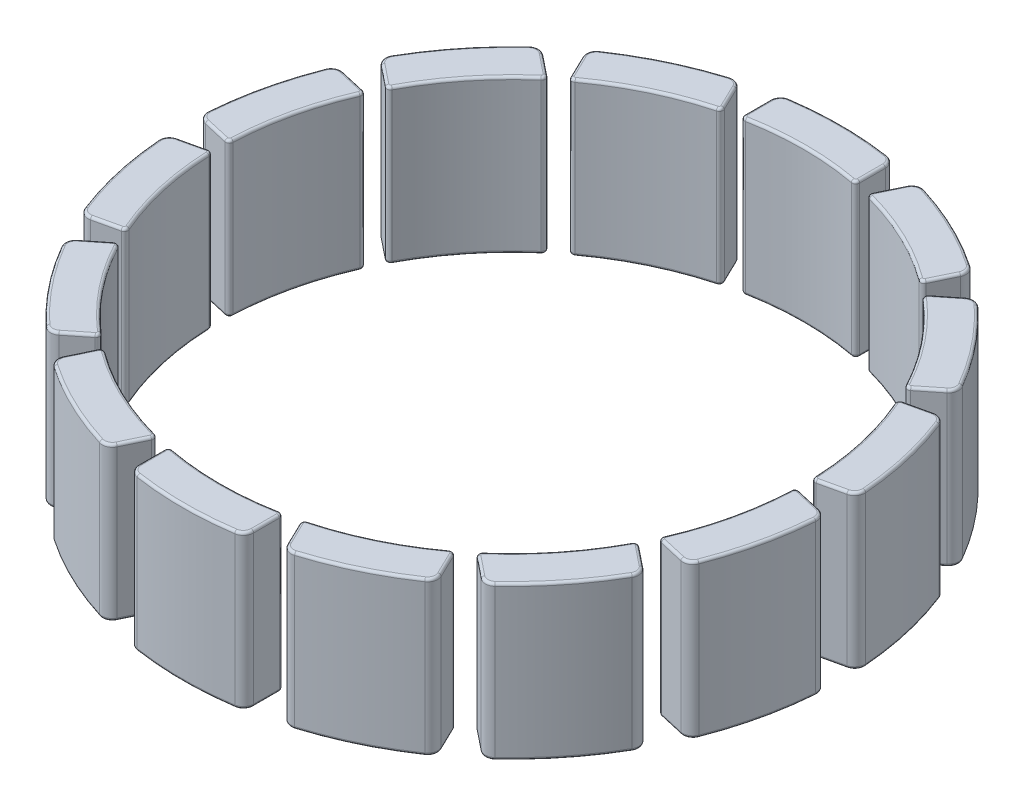
from build123d import *

# Parameters (mm, degrees)
SALIENTE_EXTRUIR1_DEPTH = 6
REDONDEO1_R             = 0.1
MATRIZC3_COUNT          = 14


with BuildPart() as part:
    # Croquis1 → Saliente-Extruir1 (new body)
    with BuildSketch(Plane(origin=(0, 0, 0), x_dir=(1, 0, 0), z_dir=(0, 1, 0))):
        with BuildLine():
            Line((-2.25, -11.357486518), (-2.25, -12.362342011))
            ThreePointArc((-2.25, -12.362342011), (-2.153051151, -12.623416713), (-1.9092, -12.757936955))
            ThreePointArc((-1.9092, -12.757936955), (0, -12.9), (1.9092, -12.757936955))
            ThreePointArc((1.9092, -12.757936955), (2.153051151, -12.623416713), (2.25, -12.362342011))
            Line((2.25, -12.362342011), (2.25, -11.357486518))
            ThreePointArc((2.25, -11.357486518), (2.195940322, -11.2421806), (2.072727273, -11.209986693))
            ThreePointArc((2.072727273, -11.209986693), (0, -11.4), (-2.072727273, -11.209986693))
            ThreePointArc((-2.072727273, -11.209986693), (-2.195940322, -11.2421806), (-2.25, -11.357486518))
        make_face()
    extrude(amount=SALIENTE_EXTRUIR1_DEPTH)

    # Redondeo1
    redondeo1_edges = [part.edges().sort_by_distance(p)[0] for p in [
        (0, 0, 12.9),
        (2.153051151, 0, 12.623416713),
        (2.25, 0, 11.859914264),
        (2.195940322, 0, 11.2421806),
        (0, 0, 11.4),
        (-2.195940322, 0, 11.2421806),
        (-2.25, 0, 11.859914264),
        (-2.153051151, 0, 12.623416713),
        (-2.25, 6, 11.859914264),
        (-2.195940322, 6, 11.2421806),
        (0, 6, 11.4),
        (2.195940322, 6, 11.2421806),
        (2.25, 6, 11.859914264),
        (2.153051151, 6, 12.623416713),
        (0, 6, 12.9),
        (-2.153051151, 6, 12.623416713),
    ]]
    fillet(redondeo1_edges, radius=REDONDEO1_R)


with BuildPart() as matrizc3_1:
    # MatrizC3: pattern copy
    add(part.part.rotate(Axis((0, 5.9, 0), (0, 1, 0)), 1 * 360 / MATRIZC3_COUNT))


with BuildPart() as matrizc3_2:
    # MatrizC3: pattern copy
    add(part.part.rotate(Axis((0, 5.9, 0), (0, 1, 0)), 2 * 360 / MATRIZC3_COUNT))


with BuildPart() as matrizc3_3:
    # MatrizC3: pattern copy
    add(part.part.rotate(Axis((0, 5.9, 0), (0, 1, 0)), 3 * 360 / MATRIZC3_COUNT))


with BuildPart() as matrizc3_4:
    # MatrizC3: pattern copy
    add(part.part.rotate(Axis((0, 5.9, 0), (0, 1, 0)), 4 * 360 / MATRIZC3_COUNT))


with BuildPart() as matrizc3_5:
    # MatrizC3: pattern copy
    add(part.part.rotate(Axis((0, 5.9, 0), (0, 1, 0)), 5 * 360 / MATRIZC3_COUNT))


with BuildPart() as matrizc3_6:
    # MatrizC3: pattern copy
    add(part.part.rotate(Axis((0, 5.9, 0), (0, 1, 0)), 6 * 360 / MATRIZC3_COUNT))


with BuildPart() as matrizc3_7:
    # MatrizC3: pattern copy
    add(part.part.rotate(Axis((0, 5.9, 0), (0, 1, 0)), 7 * 360 / MATRIZC3_COUNT))


with BuildPart() as matrizc3_8:
    # MatrizC3: pattern copy
    add(part.part.rotate(Axis((0, 5.9, 0), (0, 1, 0)), 8 * 360 / MATRIZC3_COUNT))


with BuildPart() as matrizc3_9:
    # MatrizC3: pattern copy
    add(part.part.rotate(Axis((0, 5.9, 0), (0, 1, 0)), 9 * 360 / MATRIZC3_COUNT))


with BuildPart() as matrizc3_10:
    # MatrizC3: pattern copy
    add(part.part.rotate(Axis((0, 5.9, 0), (0, 1, 0)), 10 * 360 / MATRIZC3_COUNT))


with BuildPart() as matrizc3_11:
    # MatrizC3: pattern copy
    add(part.part.rotate(Axis((0, 5.9, 0), (0, 1, 0)), 11 * 360 / MATRIZC3_COUNT))


with BuildPart() as matrizc3_12:
    # MatrizC3: pattern copy
    add(part.part.rotate(Axis((0, 5.9, 0), (0, 1, 0)), 12 * 360 / MATRIZC3_COUNT))


with BuildPart() as matrizc3_13:
    # MatrizC3: pattern copy
    add(part.part.rotate(Axis((0, 5.9, 0), (0, 1, 0)), 13 * 360 / MATRIZC3_COUNT))


solid = Compound([part.part, matrizc3_1.part, matrizc3_2.part, matrizc3_3.part, matrizc3_4.part, matrizc3_5.part, matrizc3_6.part, matrizc3_7.part, matrizc3_8.part, matrizc3_9.part, matrizc3_10.part, matrizc3_11.part, matrizc3_12.part, matrizc3_13.part])
